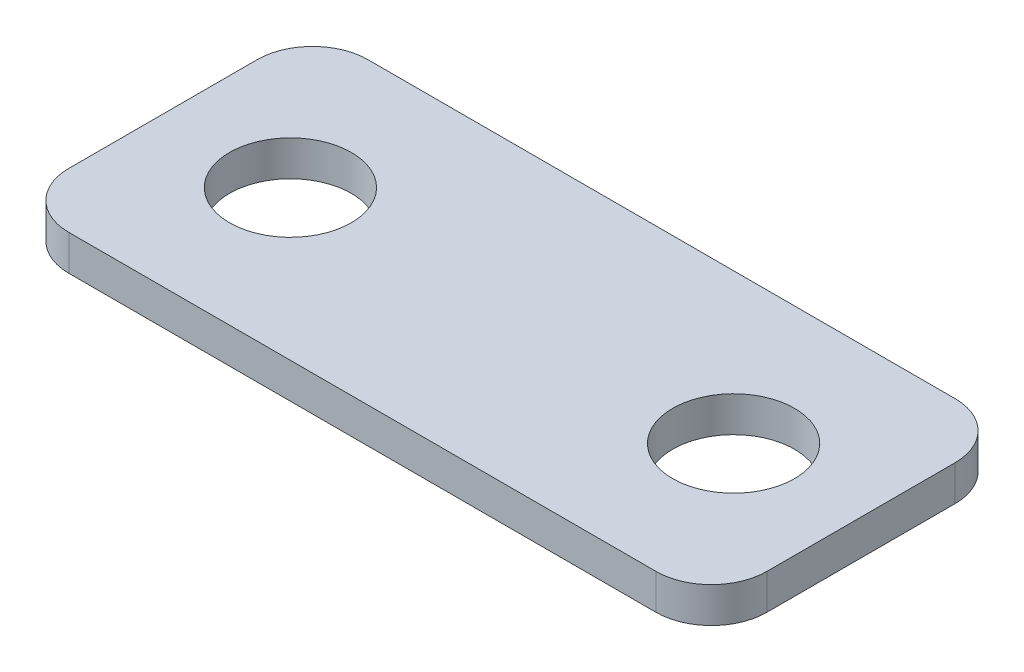
from build123d import *

# Parameters (mm, degrees)
SKETCH1_R          = 5.5
BASE_FLANGE1_DEPTH = 3.2


# Sheet-metal steps are written as plain solids
with BuildPart() as part:
    # Sketch1 → Base-Flange1 (new body)
    with BuildSketch(Plane(origin=(0, 0, 0), x_dir=(1, 0, 0), z_dir=(0, 1, 0))):
        with BuildLine():
            Line((26.5, -13.5), (-26.5, -13.5))
            ThreePointArc((-26.5, -13.5), (-30.035533906, -12.035533906), (-31.5, -8.5))
            Line((-31.5, -8.5), (-31.5, 8.5))
            ThreePointArc((-31.5, 8.5), (-30.035533906, 12.035533906), (-26.5, 13.5))
            Line((-26.5, 13.5), (26.5, 13.5))
            ThreePointArc((26.5, 13.5), (30.035533906, 12.035533906), (31.5, 8.5))
            Line((31.5, 8.5), (31.5, -8.5))
            ThreePointArc((31.5, -8.5), (30.035533906, -12.035533906), (26.5, -13.5))
        make_face()
        with Locations(Location((-20, 0, 0), (0, 0, 270))):
            Circle(SKETCH1_R, mode=Mode.SUBTRACT)
        with Locations(Location((20, 0, 0), (0, 0, 270))):
            Circle(SKETCH1_R, mode=Mode.SUBTRACT)
    extrude(amount=-BASE_FLANGE1_DEPTH)


solid = part.part
